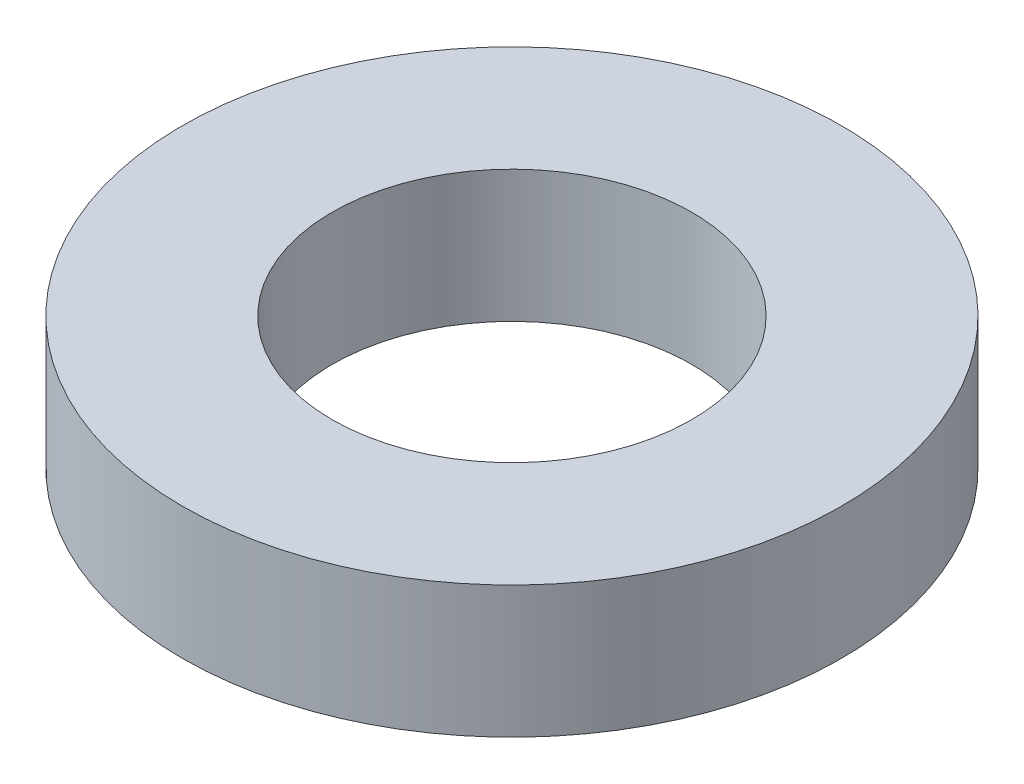
from build123d import *

# Parameters (mm, degrees)
SKETCH1_R           = 27.5
BOSS_EXTRUDE1_DEPTH = 11
SKETCH2_R           = 15
CUT_EXTRUDE1_DEPTH  = 41.416580756


with BuildPart() as part:
    # Sketch1 → Boss-Extrude1 (new body)
    with BuildSketch(Plane(origin=(0, 0, 0), x_dir=(1, 0, 0), z_dir=(0, 1, 0))):
        Circle(SKETCH1_R)
    extrude(amount=BOSS_EXTRUDE1_DEPTH)

    # Sketch2 → Cut-Extrude1 (cut, through all)
    with BuildSketch(Plane(origin=(0, 0, 0), x_dir=(1, 0, 0), z_dir=(0, 1, 0))):
        Circle(SKETCH2_R)
    extrude(amount=CUT_EXTRUDE1_DEPTH, mode=Mode.SUBTRACT)


solid = part.part
